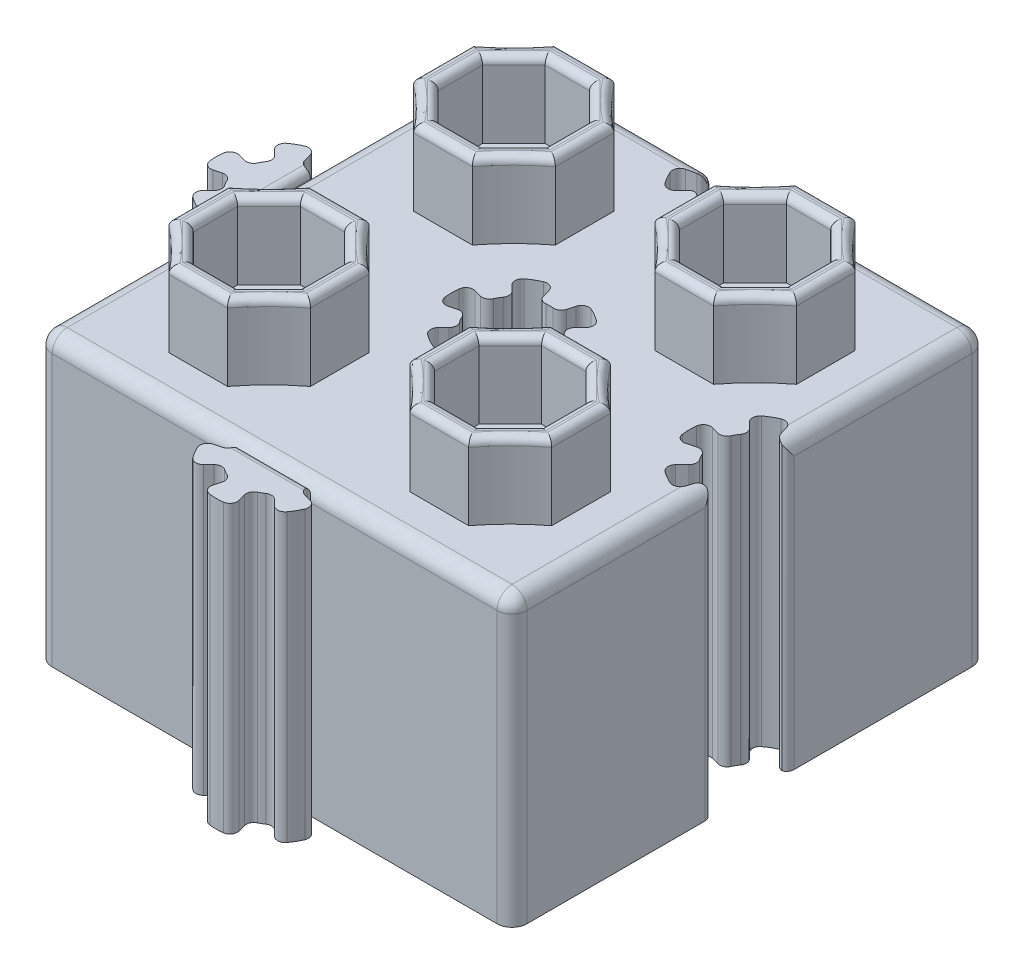
from build123d import *

# Parameters (mm, degrees)
SKETCH2_W                = 31.5
SKETCH2_H                = 31.5
BOSS_EXTRUDE1_DEPTH      = 19
CUT_EXTRUDE6_DEPTH       = 30.276697218
FILLET12_R               = 0.5
FILLET20_R               = 1
BOSS_EXTRUDE7_DEPTH      = 19
FILLET24_R               = 0.5
BOSS_EXTRUDE9_START      = -1
BOSS_EXTRUDE9_DEPTH      = 18
BOSS_EXTRUDE10_START     = -19
BOSS_EXTRUDE10_DEPTH     = 19
FILLET30_R               = 0.35
FILLET31_R               = 0.5
FILLET32_R               = 0.5
CUT_EXTRUDE13_DEPTH      = 2
CUT_EXTRUDE13_DEPTH_BACK = 1.5
BOSS_EXTRUDE11_DEPTH     = 5
FILLET33_R               = 0.5
CUT_EXTRUDE14_DEPTH      = 15
SKETCH18_W               = 1.2
SKETCH18_H               = 1.5
CUT_EXTRUDE15_DEPTH      = 0.025
CUT_EXTRUDE16_START      = -1.5
CUT_EXTRUDE16_DEPTH      = 1.5
CUT_EXTRUDE17_REACH      = 33.548
FILLET34_R               = 0.5
FILLET35_START           = -1
FILLET35_DEPTH           = 16


with BuildPart() as part:
    # Sketch2 → Boss-Extrude1 (new body)
    with BuildSketch(Plane(origin=(0, 0, 0), x_dir=(1, 0, 0), z_dir=(0, 1, 0))):
        Rectangle(SKETCH2_W, SKETCH2_H)
    extrude(amount=BOSS_EXTRUDE1_DEPTH)

    # Sketch5 → Cut-Extrude6 (cut, through all)
    with BuildSketch(Plane(origin=(0, 19, 0), x_dir=(1, 0, 0), z_dir=(0, 1, 0))):
        with BuildLine():
            Line((-2.828427125, 12.921572875), (-1.767766953, 13.982233047))
            ThreePointArc((-1.767766953, 13.982233047), (-2.165063509, 14.5), (-2.414814566, 15.102952387))
            Line((-2.414814566, 15.102952387), (-3.863703305, 14.71472382))
            ThreePointArc((-3.863703305, 14.71472382), (-3.464101615, 13.75), (-2.828427125, 12.921572875))
        make_face()
        with BuildLine():
            Line((1.03527618, 11.886296695), (0.647047613, 13.335185434))
            ThreePointArc((0.647047613, 13.335185434), (0, 13.25), (-0.647047613, 13.335185434))
            Line((-0.647047613, 13.335185434), (-1.03527618, 11.886296695))
            ThreePointArc((-1.03527618, 11.886296695), (0, 11.75), (1.03527618, 11.886296695))
        make_face()
        with BuildLine():
            ThreePointArc((2.414814566, 15.102952387), (2.165063509, 14.5), (1.767766953, 13.982233047))
            Line((1.767766953, 13.982233047), (2.828427125, 12.921572875))
            ThreePointArc((2.828427125, 12.921572875), (3.464101615, 13.75), (3.863703305, 14.71472382))
            Line((3.863703305, 14.71472382), (2.414814566, 15.102952387))
        make_face()
        with BuildLine():
            ThreePointArc((-0.647047613, 13.335185434), (0, 13.25), (0.647047613, 13.335185434))
            ThreePointArc((0.647047613, 13.335185434), (1.25, 13.584936491), (1.767766953, 13.982233047))
            ThreePointArc((1.767766953, 13.982233047), (2.165063509, 14.5), (2.414814566, 15.102952387))
            ThreePointArc((2.414814566, 15.102952387), (2.478612153, 15.423684519), (2.5, 15.75))
            Line((2.5, 15.75), (0, 15.75))
            Line((0, 15.75), (-2.5, 15.75))
            ThreePointArc((-2.5, 15.75), (-2.478612153, 15.423684519), (-2.414814566, 15.102952387))
            ThreePointArc((-2.414814566, 15.102952387), (-2.165063509, 14.5), (-1.767766953, 13.982233047))
            ThreePointArc((-1.767766953, 13.982233047), (-1.25, 13.584936491), (-0.647047613, 13.335185434))
        make_face()
        with BuildLine():
            Line((15.75, -2.5), (15.75, 0))
            Line((15.75, 0), (15.75, 2.5))
            ThreePointArc((15.75, 2.5), (15.423684519, 2.478612153), (15.102952387, 2.414814566))
            ThreePointArc((15.102952387, 2.414814566), (14.5, 2.165063509), (13.982233047, 1.767766953))
            ThreePointArc((13.982233047, 1.767766953), (13.584936491, 1.25), (13.335185434, 0.647047613))
            ThreePointArc((13.335185434, 0.647047613), (13.25, 0), (13.335185434, -0.647047613))
            ThreePointArc((13.335185434, -0.647047613), (13.584936491, -1.25), (13.982233047, -1.767766953))
            ThreePointArc((13.982233047, -1.767766953), (14.5, -2.165063509), (15.102952387, -2.414814566))
            ThreePointArc((15.102952387, -2.414814566), (15.423684519, -2.478612153), (15.75, -2.5))
        make_face()
        with BuildLine():
            ThreePointArc((13.982233047, 1.767766953), (14.5, 2.165063509), (15.102952387, 2.414814566))
            Line((15.102952387, 2.414814566), (14.71472382, 3.863703305))
            ThreePointArc((14.71472382, 3.863703305), (13.75, 3.464101615), (12.921572875, 2.828427125))
            Line((12.921572875, 2.828427125), (13.982233047, 1.767766953))
        make_face()
        with BuildLine():
            Line((11.886296695, -1.03527618), (13.335185434, -0.647047613))
            ThreePointArc((13.335185434, -0.647047613), (13.25, 0), (13.335185434, 0.647047613))
            Line((13.335185434, 0.647047613), (11.886296695, 1.03527618))
            ThreePointArc((11.886296695, 1.03527618), (11.75, 0), (11.886296695, -1.03527618))
        make_face()
        with BuildLine():
            Line((14.71472382, -3.863703305), (15.102952387, -2.414814566))
            ThreePointArc((15.102952387, -2.414814566), (14.5, -2.165063509), (13.982233047, -1.767766953))
            Line((13.982233047, -1.767766953), (12.921572875, -2.828427125))
            ThreePointArc((12.921572875, -2.828427125), (13.75, -3.464101615), (14.71472382, -3.863703305))
        make_face()
    extrude(amount=-CUT_EXTRUDE6_DEPTH, mode=Mode.SUBTRACT)

    # Fillet12
    # the kernel refuses this fillet: 0.5 mm, written as the material it adds along each edge
    with BuildSketch(Plane(origin=(-2.828427125, 19, -12.921572875), x_dir=(0.7071067811865464, 0, -0.7071067811865488), z_dir=(0, -1, 0)), Plane(origin=(3.863703305, 19, -14.71472382), x_dir=(-0.9659258262890686, 0, -0.25881904510251896), z_dir=(0, -1, 0)), Plane(origin=(1.03527618, 19, -11.886296695), x_dir=(-0.25881904510252407, 0, -0.9659258262890674), z_dir=(0, -1, 0)), Plane(origin=(14.71472382, 19, 3.863703305), x_dir=(0.2588190451025213, 0, -0.9659258262890682), z_dir=(0, -1, 0)), Plane(origin=(11.886296695, 19, 1.03527618), x_dir=(0.9659258262890664, 0, -0.258819045102527), z_dir=(0, -1, 0)), Plane(origin=(12.921572875, 19, -2.828427125), x_dir=(0.7071067811865517, 0, 0.7071067811865434), z_dir=(0, -1, 0))) as fillet12_piece_1:
        with BuildLine():
            CenterArc((0.535898385, -0.5), FILLET12_R, 90, 98.213210702)
            ThreePointArc((0.041026726, -0.571428571), (0.010269865, -0.286449736), (0, 0))
            Line((0, 0), (0.535898385, 0))
        make_face()
    extrude(amount=19)
    with BuildSketch(Plane(origin=(-3.863703305, 19, -14.71472382), x_dir=(0.32732683535398166, 0, 0.9449111825230705), z_dir=(0, -1, 0)), Plane(origin=(2.828427125, 19, -12.921572875), x_dir=(0.6546536707079763, 0, -0.7559289460184553), z_dir=(0, -1, 0)), Plane(origin=(-1.03527618, 19, -11.886296695), x_dir=(0.9819805060619656, 0, 0.18898223650461393), z_dir=(0, -1, 0)), Plane(origin=(12.921572875, 19, 2.828427125), x_dir=(0.7559289460184622, 0, 0.6546536707079684), z_dir=(0, -1, 0)), Plane(origin=(11.886296695, 19, -1.03527618), x_dir=(-0.1889822365046017, 0, 0.9819805060619681), z_dir=(0, -1, 0)), Plane(origin=(14.71472382, 19, -3.863703305), x_dir=(-0.9449111825230665, 0, 0.327326835353993), z_dir=(0, -1, 0))) as fillet12_piece_2:
        with BuildLine():
            CenterArc((0.537093255, -0.498716267), FILLET12_R, 85.893394649, 98.213210702)
            Line((0.038376988, -0.534522484), (0, 0))
            ThreePointArc((0, 0), (0.286449736, 0.010269865), (0.572899472, 0))
        make_face()
    extrude(amount=19)
    # the kernel refuses this fillet: 0.5 mm, written as the material it takes off along each edge
    with BuildSketch(Plane(origin=(15.75, 20.145099729, -2.5), x_dir=(-0.996497189454961, 0, 0.08362626027967186), z_dir=(0, -1, 0)), Plane(origin=(15.102952387, 20.145099729, 2.414814566), x_dir=(0.9841864399500989, 0, 0.1771356864619615), z_dir=(0, -1, 0)), Plane(origin=(13.335185434, 20.145099729, 0.647047613), x_dir=(0.33868921558220527, 0, 0.9408983022879309), z_dir=(0, -1, 0)), Plane(origin=(13.982233047, 20.145099729, -1.767766953), x_dir=(-0.645497224367904, 0, 0.7637626158259723), z_dir=(0, -1, 0))) as fillet12_2_piece_1:
        with BuildLine():
            CenterArc((0.459944432, 0.498248595), FILLET12_R, 184.797034113, 80.405931773)
            Line((-0.038304163, 0.456435465), (0, 0))
            ThreePointArc((0, 0), (0.209065651, 0.008757026), (0.418131301, 0))
        make_face()
    extrude(amount=21.290199458, mode=Mode.SUBTRACT)
    with BuildSketch(Plane(origin=(15.75, 20.145099729, 2.5), x_dir=(0, 0, 1), z_dir=(0, -1, 0)), Plane(origin=(13.982233047, 20.145099729, 1.767766953), x_dir=(-0.7071067811865388, 0, 0.7071067811865562), z_dir=(0, -1, 0)), Plane(origin=(13.335185434, 20.145099729, -0.647047613), x_dir=(-0.9659258262890702, 0, -0.2588190451025135), z_dir=(0, -1, 0)), Plane(origin=(15.102952387, 20.145099729, -2.414814566), x_dir=(-0.25881904510252224, 0, -0.9659258262890679), z_dir=(0, -1, 0))) as fillet12_2_piece_2:
        with BuildLine():
            CenterArc((0.458039892, 0.5), FILLET12_R, 189.594068227, 80.405931773)
            ThreePointArc((-0.034966757, 0.416666667), (-0.008757026, 0.209065651), (0, 0))
            Line((0, 0), (0.458039892, 0))
        make_face()
    extrude(amount=21.290199458, mode=Mode.SUBTRACT)

    # Fillet20
    # the kernel refuses this fillet: 1 mm, written as the material it takes off along each edge
    with BuildSketch(Plane(origin=(14.75, 18, 14.75), x_dir=(0, 0, 1), z_dir=(1, 0, 0))) as fillet20_piece_1_section:
        Polygon((0, 0), (FILLET20_R * 1.02, 0), (FILLET20_R * 1.02, -FILLET20_R * 1.02), (0, -FILLET20_R * 1.02), align=None)
    fillet20_piece_1 = extrude(amount=FILLET20_R * 1.02, mode=Mode.PRIVATE)
    fillet20_piece_1 = fillet20_piece_1 - Plane(origin=(14.75, 18, 14.75), x_dir=(0, -0.7071067811865475, -0.7071067811865475), z_dir=(1, 0, 0)) * Sphere(FILLET20_R, mode=Mode.PRIVATE)
    add(fillet20_piece_1, mode=Mode.SUBTRACT)
    with BuildSketch(Plane(origin=(14.75, 18, -14.75), x_dir=(0, 0, -1), z_dir=(0, 1, 0))) as fillet20_piece_2_section:
        Polygon((0, 0), (FILLET20_R * 1.02, 0), (FILLET20_R * 1.02, -FILLET20_R * 1.02), (0, -FILLET20_R * 1.02), align=None)
    fillet20_piece_2 = extrude(amount=FILLET20_R * 1.02, mode=Mode.PRIVATE)
    fillet20_piece_2 = fillet20_piece_2 - Plane(origin=(14.75, 18, -14.75), x_dir=(-0.7071067811865475, 0, 0.7071067811865477), z_dir=(0, 1, 0)) * Sphere(FILLET20_R, mode=Mode.PRIVATE)
    add(fillet20_piece_2, mode=Mode.SUBTRACT)
    with BuildSketch(Plane(origin=(-14.75, 18, -14.75), x_dir=(-1, 0, 0), z_dir=(0, 1, 0))) as fillet20_piece_3_section:
        Polygon((0, 0), (FILLET20_R * 1.02, 0), (FILLET20_R * 1.02, -FILLET20_R * 1.02), (0, -FILLET20_R * 1.02), align=None)
    fillet20_piece_3 = extrude(amount=FILLET20_R * 1.02, mode=Mode.PRIVATE)
    fillet20_piece_3 = fillet20_piece_3 - Plane(origin=(-14.75, 18, -14.75), x_dir=(0.7071067811865476, 0, 0.7071067811865474), z_dir=(0, 1, 0)) * Sphere(FILLET20_R, mode=Mode.PRIVATE)
    add(fillet20_piece_3, mode=Mode.SUBTRACT)
    with BuildSketch(Plane(origin=(-14.75, 18, 14.75), x_dir=(-1, 0, 0), z_dir=(0, 0, 1))) as fillet20_piece_4_section:
        Polygon((0, 0), (FILLET20_R * 1.02, 0), (FILLET20_R * 1.02, -FILLET20_R * 1.02), (0, -FILLET20_R * 1.02), align=None)
    fillet20_piece_4 = extrude(amount=FILLET20_R * 1.02, mode=Mode.PRIVATE)
    fillet20_piece_4 = fillet20_piece_4 - Plane(origin=(-14.75, 18, 14.75), x_dir=(0.7071067811865475, -0.7071067811865475, 0), z_dir=(0, 0, 1)) * Sphere(FILLET20_R, mode=Mode.PRIVATE)
    add(fillet20_piece_4, mode=Mode.SUBTRACT)
    with BuildSketch(Plane(origin=(15.75, -2.5, 15.75), x_dir=(0, 0, -1), z_dir=(0, 1, 0)), Plane(origin=(15.75, -2.5, -15.75), x_dir=(-1, 0, 0), z_dir=(0, 1, 0)), Plane(origin=(-15.75, -2.5, -15.75), x_dir=(0, 0, 1), z_dir=(0, 1, 0)), Plane(origin=(-15.75, -2.5, 15.75), x_dir=(1, 0, 0), z_dir=(0, 1, 0))) as fillet20_piece_5:
        with BuildLine():
            CenterArc((FILLET20_R, FILLET20_R), FILLET20_R, 180, 90)
            Line((0, FILLET20_R), (0, 0))
            Line((0, 0), (FILLET20_R, 0))
        make_face()
    extrude(amount=20.5, mode=Mode.SUBTRACT)
    with BuildSketch(Plane(origin=(-14.75, 19, -15.75), x_dir=(0, 0, 1), z_dir=(1, 0, 0)), Plane(origin=(0, 19, -15.75), x_dir=(0, 0, 1), z_dir=(1, 0, 0))) as fillet20_piece_6:
        with BuildLine():
            CenterArc((FILLET20_R, FILLET20_R), FILLET20_R, 180, 90)
            Line((0, FILLET20_R), (0, 0))
            Line((0, 0), (FILLET20_R, 0))
        make_face()
    extrude(amount=14.75, mode=Mode.SUBTRACT)
    with BuildSketch(Plane(origin=(15.75, 19, -14.75), x_dir=(-1, 0, 0), z_dir=(0, 0, 1)), Plane(origin=(15.75, 19, 0.458039892), x_dir=(-1, 0, 0), z_dir=(0, 0, 1))) as fillet20_piece_7:
        with BuildLine():
            CenterArc((FILLET20_R, FILLET20_R), FILLET20_R, 180, 90)
            Line((0, FILLET20_R), (0, 0))
            Line((0, 0), (FILLET20_R, 0))
        make_face()
    extrude(amount=14.291960108, mode=Mode.SUBTRACT)
    with BuildSketch(Plane(origin=(14.75, 19, 15.75), x_dir=(0, 0, -1), z_dir=(-1, 0, 0)), Plane(origin=(-15.75, 19, 14.75), x_dir=(1, 0, 0), z_dir=(0, 0, -1))) as fillet20_piece_8:
        with BuildLine():
            CenterArc((FILLET20_R, FILLET20_R), FILLET20_R, 180, 90)
            Line((0, FILLET20_R), (0, 0))
            Line((0, 0), (FILLET20_R, 0))
        make_face()
    extrude(amount=29.5, mode=Mode.SUBTRACT)

    # Sketch6 → Boss-Extrude7 (add, through all)
    with BuildSketch(Plane(origin=(0, 19, 0), x_dir=(1, 0, 0), z_dir=(0, 1, 0))):
        with BuildLine():
            ThreePointArc((-2.375, -15.75), (-2.354681546, -16.059999707), (-2.294073837, -16.364695232))
            Line((-2.294073837, -16.364695232), (-3.742962577, -16.7529238))
            ThreePointArc((-3.742962577, -16.7529238), (-3.35584844, -17.6875), (-2.740038777, -18.490038777))
            Line((-2.740038777, -18.490038777), (-1.679378605, -17.429378605))
            ThreePointArc((-1.679378605, -17.429378605), (-1.189926656, -17.805407393), (-0.620108527, -18.0426165))
            Line((-0.620108527, -18.0426165), (-1.011756018, -19.490584815))
            ThreePointArc((-1.011756018, -19.490584815), (0, -19.625), (1.011756018, -19.490584815))
            Line((1.011756018, -19.490584815), (0.620108527, -18.0426165))
            ThreePointArc((0.620108527, -18.0426165), (1.189926656, -17.805407393), (1.679378605, -17.429378605))
            Line((1.679378605, -17.429378605), (2.740038777, -18.490038777))
            ThreePointArc((2.740038777, -18.490038777), (3.35584844, -17.6875), (3.742962577, -16.7529238))
            Line((3.742962577, -16.7529238), (2.294073837, -16.364695232))
            ThreePointArc((2.294073837, -16.364695232), (2.354681546, -16.059999707), (2.375, -15.75))
            Line((2.375, -15.75), (-2.375, -15.75))
        make_face()
        with BuildLine():
            Line((-15.75, -2.375), (-15.75, 2.375))
            ThreePointArc((-15.75, 2.375), (-16.059999707, 2.354681546), (-16.364695232, 2.294073837))
            Line((-16.364695232, 2.294073837), (-16.7529238, 3.742962577))
            ThreePointArc((-16.7529238, 3.742962577), (-17.6875, 3.35584844), (-18.490038777, 2.740038777))
            Line((-18.490038777, 2.740038777), (-17.429378605, 1.679378605))
            ThreePointArc((-17.429378605, 1.679378605), (-17.806810334, 1.1875), (-18.044073837, 0.614695232))
            Line((-18.044073837, 0.614695232), (-19.492962577, 1.0029238))
            ThreePointArc((-19.492962577, 1.0029238), (-19.625, 0), (-19.492962577, -1.0029238))
            Line((-19.492962577, -1.0029238), (-18.044073837, -0.614695232))
            ThreePointArc((-18.044073837, -0.614695232), (-17.806810334, -1.1875), (-17.429378605, -1.679378605))
            Line((-17.429378605, -1.679378605), (-18.490038777, -2.740038777))
            ThreePointArc((-18.490038777, -2.740038777), (-17.6875, -3.35584844), (-16.7529238, -3.742962577))
            Line((-16.7529238, -3.742962577), (-16.364695232, -2.294073837))
            ThreePointArc((-16.364695232, -2.294073837), (-16.059999707, -2.354681546), (-15.75, -2.375))
        make_face()
    extrude(amount=-BOSS_EXTRUDE7_DEPTH)

    # Fillet24
    fillet24_edges = [part.edges().sort_by_distance(p)[0] for p in [
        (-16.364695232, 9.5, 2.294073837),
        (-16.7529238, 9.5, 3.742962577),
        (-18.490038777, 9.5, 2.740038777),
        (-17.429378605, 9.5, 1.679378605),
        (-18.044073837, 9.5, 0.614695232),
        (-19.492962577, 9.5, 1.0029238),
        (-19.492962577, 9.5, -1.0029238),
        (-18.044073837, 9.5, -0.614695232),
        (-17.429378605, 9.5, -1.679378605),
        (-18.490038777, 9.5, -2.740038777),
        (-16.7529238, 9.5, -3.742962577),
        (-16.364695232, 9.5, -2.294073837),
        (0.620108527, 9.5, 18.0426165),
        (1.011756018, 9.5, 19.490584815),
        (-1.011756018, 9.5, 19.490584815),
        (-0.620108527, 9.5, 18.0426165),
        (-1.679378605, 9.5, 17.429378605),
        (-2.740038777, 9.5, 18.490038777),
        (-3.742962577, 9.5, 16.7529238),
        (-2.294073837, 9.5, 16.364695232),
        (2.294073837, 9.5, 16.364695232),
        (3.742962577, 9.5, 16.7529238),
        (2.740038777, 9.5, 18.490038777),
        (1.679378605, 9.5, 17.429378605),
    ]]
    fillet(fillet24_edges, radius=FILLET24_R)

    # Sketch10 → Boss-Extrude9 (add, through all)
    with BuildSketch(Plane(origin=(0, 19, 0), x_dir=(1, 0, 0), z_dir=(0, 1, 0)).offset(BOSS_EXTRUDE9_START)):
        with BuildLine():
            Line((15.75, 4.4), (15.75, 4))
            ThreePointArc((15.75, 4), (11.75, 0), (15.75, -4))
            Line((15.75, -4), (15.75, -4.4))
            ThreePointArc((15.75, -4.4), (11.35, 0), (15.75, 4.4))
        make_face()
        with BuildLine():
            Line((-4.4, 15.75), (-4, 15.75))
            ThreePointArc((-4, 15.75), (0, 11.75), (4, 15.75))
            Line((4, 15.75), (4.4, 15.75))
            ThreePointArc((4.4, 15.75), (0, 11.35), (-4.4, 15.75))
        make_face()
    extrude(amount=-BOSS_EXTRUDE9_DEPTH)

    # Boss-Extrude10: read off the stored shape, not the designer's step
    # Boss-Extrude10 outline → Boss-Extrude10 (add)
    with BuildSketch(Plane(origin=(0, 19, 0), x_dir=(1, 0, 0), z_dir=(0, 1, 0)).offset(BOSS_EXTRUDE10_START)):
        with BuildLine():
            Line((13.658349934, -2.091650066), (14.070621395, -1.679378605))
            ThreePointArc((14.070621395, -1.679378605), (13.693189666, -1.1875), (13.455926163, -0.614695232))
            Line((13.455926163, -0.614695232), (12.892752874, -0.76559706))
            ThreePointArc((12.892752874, -0.76559706), (13.235075461, -0.796157468), (13.476801997, -1.040466644))
            ThreePointArc((13.476801997, -1.040466644), (13.584936491, -1.25), (13.712330453, -1.448413896))
            ThreePointArc((13.712330453, -1.448413896), (13.803045138, -1.779909805), (13.658349934, -2.091650066))
        make_face()
    extrude(amount=BOSS_EXTRUDE10_DEPTH)

    # Fillet30
    fillet30_edges = [part.edges().sort_by_distance(p)[0] for p in [
        (2.493564071, 18.571318411, -15.570728498),
        (-2.493564071, 18.571318411, -15.570728498),
        (2.5, 9, -15.75),
        (2.414814566, 9.467820642, -15.102952387),
        (-2.414814566, 9.467820642, -15.102952387),
        (-2.5, 9, -15.75),
        (-1.767766953, 9.5, -13.982233047),
        (-0.647047613, 9.5, -13.335185434),
        (0.647047613, 9.5, -13.335185434),
    ]]
    fillet(fillet30_edges, radius=FILLET30_R)

    # Fillet31
    fillet31_edges = [part.edges().sort_by_distance(p)[0] for p in [
        (0, 19, 15.75),
        (-15.75, 19, 0),
    ]]
    fillet(fillet31_edges, radius=FILLET31_R)

    # Fillet32
    fillet32_edges = [part.edges().sort_by_distance(p)[0] for p in [
        (13.455926163, 9.5, 0.614695232),
        (14.070621395, 9.5, 1.679378605),
    ]]
    fillet(fillet32_edges, radius=FILLET32_R)

    # Sketch16 → Cut-Extrude13 (cut, two sides: drawn at the far end of the back side and taken through both)
    with BuildSketch(Plane.XZ.offset(-CUT_EXTRUDE13_DEPTH_BACK)):
        with BuildLine():
            Line((-14.3, 14.3), (-8.175, 14.3))
            Line((-8.175, 14.3), (-8.175, 12.6))
            ThreePointArc((-8.175, 12.6), (-8.145710678, 12.529289322), (-8.075, 12.5))
            Line((-8.075, 12.5), (-6.825, 12.5))
            ThreePointArc((-6.825, 12.5), (-6.754289322, 12.529289322), (-6.725, 12.6))
            Line((-6.725, 12.6), (-6.725, 14.3))
            Line((-6.725, 14.3), (6.721665956, 14.3))
            Line((6.721665956, 14.3), (6.721665956, 12.6))
            ThreePointArc((6.721665956, 12.6), (6.750955278, 12.529289322), (6.821665956, 12.5))
            Line((6.821665956, 12.5), (8.071665956, 12.5))
            ThreePointArc((8.071665956, 12.5), (8.142376634, 12.529289322), (8.171665956, 12.6))
            Line((8.171665956, 12.6), (8.171665956, 14.3))
            Line((8.171665956, 14.3), (14.3, 14.3))
            Line((14.3, 14.3), (14.3, 8.175))
            Line((14.3, 8.175), (12.6, 8.175))
            ThreePointArc((12.6, 8.175), (12.529289322, 8.145710678), (12.5, 8.075))
            Line((12.5, 8.075), (12.5, 6.825))
            ThreePointArc((12.5, 6.825), (12.529289322, 6.754289322), (12.6, 6.725))
            Line((12.6, 6.725), (14.3, 6.725))
            Line((14.3, 6.725), (14.3, 4.623310502))
            ThreePointArc((14.3, 4.623310502), (11.956404012, 3.135991924), (10.82799643, 0.6))
            ThreePointArc((10.82799643, 0.6), (10.782740417, 0), (10.82799643, -0.6))
            ThreePointArc((10.82799643, -0.6), (11.956404012, -3.135991924), (14.3, -4.623310502))
            Line((14.3, -4.623310502), (14.3, -6.725))
            Line((14.3, -6.725), (12.6, -6.725))
            ThreePointArc((12.6, -6.725), (12.529289322, -6.754289322), (12.5, -6.825))
            Line((12.5, -6.825), (12.5, -8.075))
            ThreePointArc((12.5, -8.075), (12.529289322, -8.145710678), (12.6, -8.175))
            Line((12.6, -8.175), (14.3, -8.175))
            Line((14.3, -8.175), (14.3, -14.3))
            Line((14.3, -14.3), (8.35038088, -14.3))
            Line((8.35038088, -14.3), (8.171665956, -14.3))
            Line((8.171665956, -14.3), (8.171665956, -12.6))
            ThreePointArc((8.171665956, -12.6), (8.142376634, -12.529289322), (8.071665956, -12.5))
            Line((8.071665956, -12.5), (6.821665956, -12.5))
            ThreePointArc((6.821665956, -12.5), (6.750955278, -12.529289322), (6.721665956, -12.6))
            Line((6.721665956, -12.6), (6.721665956, -14.3))
            Line((6.721665956, -14.3), (4.623310502, -14.3))
            Line((4.623310502, -14.3), (4.575751304, -14.3))
            ThreePointArc((4.575751304, -14.3), (3.072656017, -12.062346952), (0.600502286, -10.987710949))
            ThreePointArc((0.600502286, -10.987710949), (-0.001645996, -10.942336934), (-0.603763067, -10.988123252))
            ThreePointArc((-0.603763067, -10.988123252), (-3.073918375, -12.063399151), (-4.575751304, -14.3))
            Line((-4.575751304, -14.3), (-4.623310502, -14.3))
            Line((-4.623310502, -14.3), (-6.725, -14.3))
            Line((-6.725, -14.3), (-6.725, -12.6))
            ThreePointArc((-6.725, -12.6), (-6.754289322, -12.529289322), (-6.825, -12.5))
            Line((-6.825, -12.5), (-8.075, -12.5))
            ThreePointArc((-8.075, -12.5), (-8.145710678, -12.529289322), (-8.175, -12.6))
            Line((-8.175, -12.6), (-8.175, -14.3))
            Line((-8.175, -14.3), (-14.3, -14.3))
            Line((-14.3, -14.3), (-14.3, -8.175))
            Line((-14.3, -8.175), (-12.6, -8.175))
            ThreePointArc((-12.6, -8.175), (-12.529289322, -8.145710678), (-12.5, -8.075))
            Line((-12.5, -8.075), (-12.5, -6.825))
            ThreePointArc((-12.5, -6.825), (-12.529289322, -6.754289322), (-12.6, -6.725))
            Line((-12.6, -6.725), (-14.3, -6.725))
            Line((-14.3, -6.725), (-14.3, 6.725))
            Line((-14.3, 6.725), (-12.6, 6.725))
            ThreePointArc((-12.6, 6.725), (-12.529289322, 6.754289322), (-12.5, 6.825))
            Line((-12.5, 6.825), (-12.5, 8.075))
            ThreePointArc((-12.5, 8.075), (-12.529289322, 8.145710678), (-12.6, 8.175))
            Line((-12.6, 8.175), (-14.3, 8.175))
            Line((-14.3, 8.175), (-14.3, 14.3))
        make_face()
    extrude(amount=CUT_EXTRUDE13_DEPTH + CUT_EXTRUDE13_DEPTH_BACK, mode=Mode.SUBTRACT)

    # Sketch3 → Boss-Extrude11 (add)
    # profile 1 of 4: a face of its own
    with BuildSketch(Plane(origin=(0, 19, 0), x_dir=(1, 0, 0), z_dir=(0, 1, 0))):
        with BuildLine():
            ThreePointArc((-9.946803743, 3.421093296), (-11.233690264, 4.887403031), (-12.7, 6.174289552))
            Line((-12.7, 6.174289552), (-12.7, 10.067897039))
            ThreePointArc((-12.7, 10.067897039), (-11.233690264, 11.35478356), (-9.946803743, 12.821093296))
            Line((-9.946803743, 12.821093296), (-6.053196257, 12.821093296))
            ThreePointArc((-6.053196257, 12.821093296), (-4.766309736, 11.35478356), (-3.3, 10.067897039))
            Line((-3.3, 10.067897039), (-3.3, 6.174289552))
            ThreePointArc((-3.3, 6.174289552), (-4.766309736, 4.887403031), (-6.053196257, 3.421093296))
            Line((-6.053196257, 3.421093296), (-9.946803743, 3.421093296))
        make_face()
        Polygon((-9.470458146, 4.571093296), (-6.529541854, 4.571093296), (-4.45, 6.650635149), (-4.45, 9.591551442), (-6.529541854, 11.671093296), (-9.470458146, 11.671093296), (-11.55, 9.591551442), (-11.55, 6.650635149), align=None, mode=Mode.SUBTRACT)
    # profile 2 of 4: a face of its own
    with BuildSketch(Plane(origin=(0, 19, 0), x_dir=(1, 0, 0), z_dir=(0, 1, 0))):
        with BuildLine():
            Line((12.7, 10.067897039), (12.7, 6.174289552))
            ThreePointArc((12.7, 6.174289552), (11.233690264, 4.887403031), (9.946803743, 3.421093296))
            Line((9.946803743, 3.421093296), (6.053196257, 3.421093296))
            ThreePointArc((6.053196257, 3.421093296), (4.766309736, 4.887403031), (3.3, 6.174289552))
            Line((3.3, 6.174289552), (3.3, 10.067897039))
            ThreePointArc((3.3, 10.067897039), (4.766309736, 11.35478356), (6.053196257, 12.821093296))
            Line((6.053196257, 12.821093296), (9.946803743, 12.821093296))
            ThreePointArc((9.946803743, 12.821093296), (11.233690264, 11.35478356), (12.7, 10.067897039))
        make_face()
        Polygon((9.470458146, 4.571093296), (6.529541854, 4.571093296), (4.45, 6.650635149), (4.45, 9.591551442), (6.529541854, 11.671093296), (9.470458146, 11.671093296), (11.55, 9.591551442), (11.55, 6.650635149), align=None, mode=Mode.SUBTRACT)
    # profile 3 of 4: a face of its own
    with BuildSketch(Plane(origin=(0, 19, 0), x_dir=(1, 0, 0), z_dir=(0, 1, 0))):
        with BuildLine():
            ThreePointArc((9.946803743, -3.421093296), (11.233690264, -4.887403031), (12.7, -6.174289552))
            Line((12.7, -6.174289552), (12.7, -10.067897039))
            ThreePointArc((12.7, -10.067897039), (11.233690264, -11.35478356), (9.946803743, -12.821093296))
            Line((9.946803743, -12.821093296), (6.053196257, -12.821093296))
            ThreePointArc((6.053196257, -12.821093296), (4.766309736, -11.35478356), (3.3, -10.067897039))
            Line((3.3, -10.067897039), (3.3, -6.174289552))
            ThreePointArc((3.3, -6.174289552), (4.766309736, -4.887403031), (6.053196257, -3.421093296))
            Line((6.053196257, -3.421093296), (9.946803743, -3.421093296))
        make_face()
        Polygon((9.470458146, -4.571093296), (6.529541854, -4.571093296), (4.45, -6.650635149), (4.45, -9.591551442), (6.529541854, -11.671093296), (9.470458146, -11.671093296), (11.55, -9.591551442), (11.55, -6.650635149), align=None, mode=Mode.SUBTRACT)
    # profile 4 of 4: a face of its own
    with BuildSketch(Plane(origin=(0, 19, 0), x_dir=(1, 0, 0), z_dir=(0, 1, 0))):
        with BuildLine():
            Line((-12.7, -10.067897039), (-12.7, -6.174289552))
            ThreePointArc((-12.7, -6.174289552), (-11.233690264, -4.887403031), (-9.946803743, -3.421093296))
            Line((-9.946803743, -3.421093296), (-6.053196257, -3.421093296))
            ThreePointArc((-6.053196257, -3.421093296), (-4.766309736, -4.887403031), (-3.3, -6.174289552))
            Line((-3.3, -6.174289552), (-3.3, -10.067897039))
            ThreePointArc((-3.3, -10.067897039), (-4.766309736, -11.35478356), (-6.053196257, -12.821093296))
            Line((-6.053196257, -12.821093296), (-9.946803743, -12.821093296))
            ThreePointArc((-9.946803743, -12.821093296), (-11.233690264, -11.35478356), (-12.7, -10.067897039))
        make_face()
        Polygon((-9.470458146, -4.571093296), (-6.529541854, -4.571093296), (-4.45, -6.650635149), (-4.45, -9.591551442), (-6.529541854, -11.671093296), (-9.470458146, -11.671093296), (-11.55, -9.591551442), (-11.55, -6.650635149), align=None, mode=Mode.SUBTRACT)
    extrude(amount=BOSS_EXTRUDE11_DEPTH)

    # Fillet33
    fillet33_edges = [part.edges().sort_by_distance(p)[0] for p in [
        (-8, 24, -4.571093296),
        (-10.510229073, 24, -5.610864222),
        (-11.55, 24, -8.121093296),
        (-10.510229073, 24, -10.631322369),
        (-8, 24, -11.671093296),
        (-5.489770927, 24, -10.631322369),
        (-4.45, 24, -8.121093296),
        (-11.233690264, 24, -4.887403031),
        (-4.766309736, 24, -11.35478356),
        (-11.233690264, 24, -11.35478356),
        (-5.489770927, 24, -5.610864222),
        (-8, 24, -3.421093296),
        (-4.766309736, 24, -4.887403031),
        (-3.3, 24, -8.121093296),
        (-8, 24, -12.821093296),
        (-12.7, 24, -8.121093296),
        (12.7, 24, -8.121093296),
        (8, 24, -12.821093296),
        (3.3, 24, -8.121093296),
        (4.766309736, 24, -4.887403031),
        (8, 24, -3.421093296),
        (8, 24, -4.571093296),
        (5.489770927, 24, -5.610864222),
        (4.45, 24, -8.121093296),
        (5.489770927, 24, -10.631322369),
        (8, 24, -11.671093296),
        (10.510229073, 24, -10.631322369),
        (11.55, 24, -8.121093296),
        (10.510229073, 24, -5.610864222),
        (11.233690264, 24, -11.35478356),
        (4.766309736, 24, -11.35478356),
        (11.233690264, 24, -4.887403031),
        (8, 24, 4.571093296),
        (10.510229073, 24, 5.610864222),
        (11.55, 24, 8.121093296),
        (10.510229073, 24, 10.631322369),
        (8, 24, 11.671093296),
        (5.489770927, 24, 10.631322369),
        (4.45, 24, 8.121093296),
        (11.233690264, 24, 4.887403031),
        (4.766309736, 24, 11.35478356),
        (11.233690264, 24, 11.35478356),
        (5.489770927, 24, 5.610864222),
        (8, 24, 3.421093296),
        (4.766309736, 24, 4.887403031),
        (3.3, 24, 8.121093296),
        (8, 24, 12.821093296),
        (12.7, 24, 8.121093296),
        (-12.7, 24, 8.121093296),
        (-8, 24, 12.821093296),
        (-3.3, 24, 8.121093296),
        (-4.766309736, 24, 4.887403031),
        (-8, 24, 3.421093296),
        (-8, 24, 4.571093296),
        (-5.489770927, 24, 5.610864222),
        (-4.45, 24, 8.121093296),
        (-5.489770927, 24, 10.631322369),
        (-8, 24, 11.671093296),
        (-10.510229073, 24, 10.631322369),
        (-11.55, 24, 8.121093296),
        (-10.510229073, 24, 5.610864222),
        (-11.233690264, 24, 11.35478356),
        (-4.766309736, 24, 11.35478356),
        (-11.233690264, 24, 4.887403031),
    ]]
    fillet(fillet33_edges, radius=FILLET33_R)

    # Sketch7 → Cut-Extrude14 (cut)
    with BuildSketch(Plane.XZ):
        with BuildLine():
            ThreePointArc((-4.259988263, -14.3), (-2.859722023, -12.275523068), (-0.603763067, -11.290687255))
            Line((-0.603763067, -11.290687255), (-0.603763067, -4.963413156))
            ThreePointArc((-0.603763067, -4.963413156), (-1.845028292, -4.647135742), (-2.965202778, -4.025862949))
            Line((-2.965202778, -4.025862949), (-3.959797975, -5.020458146))
            Line((-3.959797975, -5.020458146), (-5.020458146, -3.959797975))
            Line((-5.020458146, -3.959797975), (-4.027923069, -2.962403712))
            ThreePointArc((-4.027923069, -2.962403712), (-4.64847513, -1.841651151), (-4.963869458, -0.6))
            Line((-4.963869458, -0.6), (-14.325, -0.6))
            Line((-14.325, -0.6), (-14.325, -6.725))
            Line((-14.325, -6.725), (-12.675, -6.725))
            Line((-12.675, -6.725), (-12.675, -7.3))
            Line((-12.675, -7.3), (-14.325, -7.3))
            Line((-14.325, -7.3), (-14.325, -14.3))
            Line((-14.325, -14.3), (-7.325, -14.3))
            Line((-7.325, -14.3), (-7.325, -12.65))
            Line((-7.325, -12.65), (-6.725, -12.65))
            Line((-6.725, -12.65), (-6.725, -14.3))
            Line((-6.725, -14.3), (-4.259988263, -14.3))
        make_face()
        with BuildLine():
            ThreePointArc((14.3, -4.259988263), (12.274316834, -2.858255854), (11.290179376, -0.6))
            Line((11.290179376, -0.6), (4.963869458, -0.6))
            ThreePointArc((4.963869458, -0.6), (4.64847513, -1.841651151), (4.027923069, -2.962403712))
            Line((4.027923069, -2.962403712), (5.020458146, -3.959797975))
            Line((5.020458146, -3.959797975), (3.959797975, -5.020458146))
            Line((3.959797975, -5.020458146), (2.965202778, -4.025862949))
            ThreePointArc((2.965202778, -4.025862949), (1.843266601, -4.64783479), (0.6, -4.963869458))
            Line((0.6, -4.963869458), (0.6, -11.290179376))
            ThreePointArc((0.6, -11.290179376), (2.86843208, -12.282710367), (4.268415983, -14.325))
            Line((4.268415983, -14.325), (6.7, -14.325))
            Line((6.7, -14.325), (6.7, -12.525))
            Line((6.7, -12.525), (7.3, -12.525))
            Line((7.3, -12.525), (7.3, -14.325))
            Line((7.3, -14.325), (14.3, -14.325))
            Line((14.3, -14.325), (14.3, -7.325))
            Line((14.3, -7.325), (12.65, -7.325))
            Line((12.65, -7.325), (12.65, -6.725))
            Line((12.65, -6.725), (14.3, -6.725))
            Line((14.3, -6.725), (14.3, -4.259988263))
        make_face()
        with BuildLine():
            Line((7.571665956, 14.3), (0.6, 14.3))
            Line((0.6, 14.3), (0.6, 4.963869458))
            ThreePointArc((0.6, 4.963869458), (1.843266601, 4.64783479), (2.965202778, 4.025862949))
            Line((2.965202778, 4.025862949), (3.959797975, 5.020458146))
            Line((3.959797975, 5.020458146), (5.020458146, 3.959797975))
            Line((5.020458146, 3.959797975), (4.027923069, 2.962403712))
            ThreePointArc((4.027923069, 2.962403712), (4.64847513, 1.841651151), (4.963869458, 0.6))
            Line((4.963869458, 0.6), (11.290179376, 0.6))
            ThreePointArc((11.290179376, 0.6), (12.274316834, 2.858255854), (14.3, 4.259988263))
            Line((14.3, 4.259988263), (14.3, 6.7))
            Line((14.3, 6.7), (12.5, 6.7))
            Line((12.5, 6.7), (12.5, 7.3))
            Line((12.5, 7.3), (14.3, 7.3))
            Line((14.3, 7.3), (14.3, 14.3))
            Line((14.3, 14.3), (8.171665956, 14.3))
            Line((8.171665956, 14.3), (8.171665956, 12.65))
            Line((8.171665956, 12.65), (7.571665956, 12.65))
            Line((7.571665956, 12.65), (7.571665956, 14.3))
        make_face()
        with BuildLine():
            Line((-7.325, 14.3), (-14.325, 14.3))
            Line((-14.325, 14.3), (-14.325, 7.3))
            Line((-14.325, 7.3), (-12.525, 7.3))
            Line((-12.525, 7.3), (-12.525, 6.7))
            Line((-12.525, 6.7), (-14.325, 6.7))
            Line((-14.325, 6.7), (-14.325, 0.6))
            Line((-14.325, 0.6), (-4.963869458, 0.6))
            ThreePointArc((-4.963869458, 0.6), (-4.64847513, 1.841651151), (-4.027923069, 2.962403712))
            Line((-4.027923069, 2.962403712), (-5.020458146, 3.959797975))
            Line((-5.020458146, 3.959797975), (-3.959797975, 5.020458146))
            Line((-3.959797975, 5.020458146), (-2.965202778, 4.025862949))
            ThreePointArc((-2.965202778, 4.025862949), (-1.845028292, 4.647135742), (-0.603763067, 4.963413156))
            Line((-0.603763067, 4.963413156), (-0.603763067, 14.3))
            Line((-0.603763067, 14.3), (-6.725, 14.3))
            Line((-6.725, 14.3), (-6.725, 12.65))
            Line((-6.725, 12.65), (-7.325, 12.65))
            Line((-7.325, 12.65), (-7.325, 14.3))
        make_face()
        with BuildLine():
            ThreePointArc((2.828427125, 2.828427125), (2, 3.464101615), (1.03527618, 3.863703305))
            Line((1.03527618, 3.863703305), (0.647047613, 2.414814566))
            ThreePointArc((0.647047613, 2.414814566), (0, 2.5), (-0.647047613, 2.414814566))
            Line((-0.647047613, 2.414814566), (-1.03527618, 3.863703305))
            ThreePointArc((-1.03527618, 3.863703305), (-2, 3.464101615), (-2.828427125, 2.828427125))
            Line((-2.828427125, 2.828427125), (-1.767766953, 1.767766953))
            ThreePointArc((-1.767766953, 1.767766953), (-2.165063509, 1.25), (-2.414814566, 0.647047613))
            Line((-2.414814566, 0.647047613), (-3.863703305, 1.03527618))
            ThreePointArc((-3.863703305, 1.03527618), (-4, 0), (-3.863703305, -1.03527618))
            Line((-3.863703305, -1.03527618), (-2.414814566, -0.647047613))
            ThreePointArc((-2.414814566, -0.647047613), (-2.165063509, -1.25), (-1.767766953, -1.767766953))
            Line((-1.767766953, -1.767766953), (-2.828427125, -2.828427125))
            ThreePointArc((-2.828427125, -2.828427125), (-2, -3.464101615), (-1.03527618, -3.863703305))
            Line((-1.03527618, -3.863703305), (-0.647047613, -2.414814566))
            ThreePointArc((-0.647047613, -2.414814566), (0, -2.5), (0.647047613, -2.414814566))
            Line((0.647047613, -2.414814566), (1.03527618, -3.863703305))
            ThreePointArc((1.03527618, -3.863703305), (2, -3.464101615), (2.828427125, -2.828427125))
            Line((2.828427125, -2.828427125), (1.767766953, -1.767766953))
            ThreePointArc((1.767766953, -1.767766953), (2.165063509, -1.25), (2.414814566, -0.647047613))
            Line((2.414814566, -0.647047613), (3.863703305, -1.03527618))
            ThreePointArc((3.863703305, -1.03527618), (4, 0), (3.863703305, 1.03527618))
            Line((3.863703305, 1.03527618), (2.414814566, 0.647047613))
            ThreePointArc((2.414814566, 0.647047613), (2.165063509, 1.25), (1.767766953, 1.767766953))
            Line((1.767766953, 1.767766953), (2.828427125, 2.828427125))
        make_face()
    extrude(amount=-CUT_EXTRUDE14_DEPTH, mode=Mode.SUBTRACT)

    # Sketch18 → Cut-Extrude15 (cut)
    with BuildSketch(Plane(origin=(-14.3, 0, 0), x_dir=(0, 0, -1), z_dir=(1, 0, 0))):
        with Locations((0, 0.75)):
            Rectangle(SKETCH18_W, SKETCH18_H)
    extrude(amount=-CUT_EXTRUDE15_DEPTH, mode=Mode.SUBTRACT)

    # Sketch19 → Cut-Extrude16 (cut)
    with BuildSketch(Plane.XZ.offset(CUT_EXTRUDE16_START)):
        with BuildLine():
            Line((-0.603763067, -11.290687255), (-0.603763067, -10.988123252))
            ThreePointArc((-0.603763067, -10.988123252), (-0.001900018, -10.942337029), (0.6, -10.987634675))
            Line((0.6, -10.987634675), (0.6, -11.290179376))
            ThreePointArc((0.6, -11.290179376), (-0.001900748, -11.24489138), (-0.603763067, -11.290687255))
        make_face()
        with BuildLine():
            Line((11.290179376, 0.6), (10.82799643, 0.6))
            ThreePointArc((10.82799643, 0.6), (10.782740417, 0), (10.82799643, -0.6))
            Line((10.82799643, -0.6), (11.290179376, -0.6))
            ThreePointArc((11.290179376, -0.6), (11.244923362, 0), (11.290179376, 0.6))
        make_face()
    extrude(amount=CUT_EXTRUDE16_DEPTH, mode=Mode.SUBTRACT)

    # Sketch20 → Cut-Extrude17 (cut, up to next)
    with BuildSketch(Plane.XZ.offset(-15), mode=Mode.PRIVATE) as cut_extrude17_sk1:
        with BuildLine():
            ThreePointArc((-1.03527618, 3.863703305), (-2, 3.464101615), (-2.828427125, 2.828427125))
            Line((-2.828427125, 2.828427125), (-1.767766953, 1.767766953))
            ThreePointArc((-1.767766953, 1.767766953), (-2.165063509, 1.25), (-2.414814566, 0.647047613))
            Line((-2.414814566, 0.647047613), (-3.863703305, 1.03527618))
            ThreePointArc((-3.863703305, 1.03527618), (-4, 0), (-3.863703305, -1.03527618))
            Line((-3.863703305, -1.03527618), (-2.414814566, -0.647047613))
            ThreePointArc((-2.414814566, -0.647047613), (-2.165063509, -1.25), (-1.767766953, -1.767766953))
            Line((-1.767766953, -1.767766953), (-2.828427125, -2.828427125))
            ThreePointArc((-2.828427125, -2.828427125), (-2, -3.464101615), (-1.03527618, -3.863703305))
            Line((-1.03527618, -3.863703305), (-0.647047613, -2.414814566))
            ThreePointArc((-0.647047613, -2.414814566), (0, -2.5), (0.647047613, -2.414814566))
            Line((0.647047613, -2.414814566), (1.03527618, -3.863703305))
            ThreePointArc((1.03527618, -3.863703305), (2, -3.464101615), (2.828427125, -2.828427125))
            Line((2.828427125, -2.828427125), (1.767766953, -1.767766953))
            ThreePointArc((1.767766953, -1.767766953), (2.165063509, -1.25), (2.414814566, -0.647047613))
            Line((2.414814566, -0.647047613), (3.863703305, -1.03527618))
            ThreePointArc((3.863703305, -1.03527618), (4, 0), (3.863703305, 1.03527618))
            Line((3.863703305, 1.03527618), (2.414814566, 0.647047613))
            ThreePointArc((2.414814566, 0.647047613), (2.165063509, 1.25), (1.767766953, 1.767766953))
            Line((1.767766953, 1.767766953), (2.828427125, 2.828427125))
            ThreePointArc((2.828427125, 2.828427125), (2, 3.464101615), (1.03527618, 3.863703305))
            Line((1.03527618, 3.863703305), (0.647047613, 2.414814566))
            ThreePointArc((0.647047613, 2.414814566), (0, 2.5), (-0.647047613, 2.414814566))
            Line((-0.647047613, 2.414814566), (-1.03527618, 3.863703305))
        make_face()
    cut_extrude17_tool1 = extrude(cut_extrude17_sk1.sketch, amount=-CUT_EXTRUDE17_REACH, mode=Mode.PRIVATE) & part.part
    add(cut_extrude17_tool1.solids().sort_by_distance((0, 15, 0))[0], mode=Mode.SUBTRACT)

    # Fillet34
    fillet34_edges = [part.edges().sort_by_distance(p)[0] for p in [
        (-1.767766953, 10.25, 1.767766953),
        (-2.828427125, 10.25, 2.828427125),
        (-1.03527618, 10.25, 3.863703305),
        (-0.647047613, 10.25, 2.414814566),
        (0.647047613, 10.25, 2.414814566),
        (1.03527618, 10.25, 3.863703305),
        (2.828427125, 10.25, 2.828427125),
        (1.767766953, 10.25, 1.767766953),
        (2.414814566, 10.25, 0.647047613),
        (3.863703305, 10.25, 1.03527618),
        (3.863703305, 10.25, -1.03527618),
        (2.414814566, 10.25, -0.647047613),
        (1.767766953, 10.25, -1.767766953),
        (2.828427125, 10.25, -2.828427125),
        (1.03527618, 10.25, -3.863703305),
        (0.647047613, 10.25, -2.414814566),
        (-0.647047613, 10.25, -2.414814566),
        (-1.03527618, 10.25, -3.863703305),
        (-2.828427125, 10.25, -2.828427125),
        (-1.767766953, 10.25, -1.767766953),
        (-2.414814566, 10.25, -0.647047613),
        (-3.863703305, 10.25, -1.03527618),
        (-3.863703305, 10.25, 1.03527618),
        (-2.414814566, 10.25, 0.647047613),
    ]]
    fillet(fillet34_edges, radius=FILLET34_R)

    # Fillet35: read off the stored shape, not the designer's step
    # Fillet35 outline → Fillet35 (cut)
    with BuildSketch(Plane(origin=(0, 0, 0), x_dir=(1, 0, 0), z_dir=(0, 1, 0)).offset(FILLET35_START)):
        with BuildLine():
            Line((5.020458146, 3.959797975), (4.879381704, 4.100874417))
            ThreePointArc((4.879381704, 4.100874417), (4.937960198, 3.959697249), (4.879726616, 3.818377461))
            Line((4.879726616, 3.818377461), (5.020458146, 3.959797975))
        make_face()
        with BuildLine():
            ThreePointArc((3.818376618, 4.87903679), (3.959797974, 4.937615434), (4.101219331, 4.87903679))
            Line((4.101219331, 4.87903679), (3.959797975, 5.020458146))
            Line((3.959797975, 5.020458146), (3.818376618, 4.87903679))
        make_face()
        with BuildLine():
            Line((-3.959797975, 5.020458146), (-4.101219331, 4.87903679))
            ThreePointArc((-4.101219331, 4.87903679), (-3.959797974, 4.937615434), (-3.818376618, 4.87903679))
            Line((-3.818376618, 4.87903679), (-3.959797975, 5.020458146))
        make_face()
        with BuildLine():
            ThreePointArc((-4.879726616, 3.818377461), (-4.937960198, 3.959697249), (-4.879381704, 4.100874417))
            Line((-4.879381704, 4.100874417), (-5.020458146, 3.959797975))
            Line((-5.020458146, 3.959797975), (-4.879726616, 3.818377461))
        make_face()
        with BuildLine():
            Line((-7.325, 12.65), (-7.125, 12.65))
            ThreePointArc((-7.125, 12.65), (-7.266421356, 12.708578644), (-7.325, 12.85))
            Line((-7.325, 12.85), (-7.325, 12.65))
        make_face()
        with BuildLine():
            ThreePointArc((-6.725, 12.85), (-6.783578644, 12.708578644), (-6.925, 12.65))
            Line((-6.925, 12.65), (-6.725, 12.65))
            Line((-6.725, 12.65), (-6.725, 12.85))
        make_face()
        with BuildLine():
            Line((6.755522173, 12.525), (6.9, 12.525))
            ThreePointArc((6.9, 12.525), (6.758578644, 12.583578644), (6.7, 12.725))
            Line((6.7, 12.725), (6.7, 12.525))
            Line((6.7, 12.525), (6.755522173, 12.525))
        make_face()
        with BuildLine():
            ThreePointArc((7.3, 12.725), (7.241421356, 12.583578644), (7.1, 12.525))
            Line((7.1, 12.525), (7.3, 12.525))
            Line((7.3, 12.525), (7.3, 12.725))
        make_face()
        with BuildLine():
            Line((-12.675, 7.3), (-12.875, 7.3))
            ThreePointArc((-12.875, 7.3), (-12.733578644, 7.241421356), (-12.675, 7.1))
            Line((-12.675, 7.1), (-12.675, 7.3))
        make_face()
        with BuildLine():
            Line((-12.675, 6.725), (-12.675, 6.925))
            ThreePointArc((-12.675, 6.925), (-12.733578644, 6.783578644), (-12.875, 6.725))
            Line((-12.875, 6.725), (-12.675, 6.725))
        make_face()
        with BuildLine():
            ThreePointArc((12.85, 6.725), (12.708578644, 6.783578644), (12.65, 6.925))
            Line((12.65, 6.925), (12.65, 6.725))
            Line((12.65, 6.725), (12.85, 6.725))
        make_face()
        with BuildLine():
            Line((12.65, 7.325), (12.65, 7.125))
            ThreePointArc((12.65, 7.125), (12.708578644, 7.266421356), (12.85, 7.325))
            Line((12.85, 7.325), (12.65, 7.325))
        make_face()
        with BuildLine():
            Line((-12.525, -6.7), (-12.725, -6.7))
            ThreePointArc((-12.725, -6.7), (-12.583578644, -6.758578644), (-12.525, -6.9))
            Line((-12.525, -6.9), (-12.525, -6.758856217))
            Line((-12.525, -6.758856217), (-12.525, -6.7))
        make_face()
        with BuildLine():
            Line((-12.525, -7.3), (-12.525, -7.1))
            ThreePointArc((-12.525, -7.1), (-12.583578644, -7.241421356), (-12.725, -7.3))
            Line((-12.725, -7.3), (-12.525, -7.3))
        make_face()
        with BuildLine():
            Line((3.959797975, -5.020458146), (4.101219331, -4.87903679))
            ThreePointArc((4.101219331, -4.87903679), (3.959797974, -4.937615434), (3.818376618, -4.87903679))
            Line((3.818376618, -4.87903679), (3.959797975, -5.020458146))
        make_face()
        with BuildLine():
            ThreePointArc((4.879726616, -3.818377461), (4.937960198, -3.959697249), (4.879381704, -4.100874417))
            Line((4.879381704, -4.100874417), (5.020458146, -3.959797975))
            Line((5.020458146, -3.959797975), (4.879726616, -3.818377461))
        make_face()
        with BuildLine():
            Line((-5.020458146, -3.959797975), (-4.879381704, -4.100874417))
            ThreePointArc((-4.879381704, -4.100874417), (-4.937960198, -3.959697249), (-4.879726616, -3.818377461))
            Line((-4.879726616, -3.818377461), (-5.020458146, -3.959797975))
        make_face()
        with BuildLine():
            ThreePointArc((-3.818376618, -4.87903679), (-3.959797974, -4.937615434), (-4.101219331, -4.87903679))
            Line((-4.101219331, -4.87903679), (-3.959797975, -5.020458146))
            Line((-3.959797975, -5.020458146), (-3.818376618, -4.87903679))
        make_face()
        with BuildLine():
            Line((12.5, -6.825), (12.5, -6.9))
            ThreePointArc((12.5, -6.9), (12.558578644, -6.758578644), (12.7, -6.7))
            Line((12.7, -6.7), (12.5, -6.7))
            Line((12.5, -6.7), (12.5, -6.825))
        make_face()
        with BuildLine():
            ThreePointArc((12.7, -7.3), (12.558578644, -7.241421356), (12.5, -7.1))
            Line((12.5, -7.1), (12.5, -7.3))
            Line((12.5, -7.3), (12.7, -7.3))
        make_face()
        with BuildLine():
            Line((7.571665956, -12.65), (7.571665956, -12.85))
            ThreePointArc((7.571665956, -12.85), (7.6302446, -12.708578644), (7.771665956, -12.65))
            Line((7.771665956, -12.65), (7.571665956, -12.65))
        make_face()
        with BuildLine():
            Line((8.171665956, -12.65), (7.971665956, -12.65))
            ThreePointArc((7.971665956, -12.65), (8.113087312, -12.708578644), (8.171665956, -12.85))
            Line((8.171665956, -12.85), (8.171665956, -12.65))
        make_face()
        with BuildLine():
            Line((-7.325, -12.65), (-7.325, -12.85))
            ThreePointArc((-7.325, -12.85), (-7.266421356, -12.708578644), (-7.125, -12.65))
            Line((-7.125, -12.65), (-7.325, -12.65))
        make_face()
        with BuildLine():
            Line((-6.725, -12.65), (-6.925, -12.65))
            ThreePointArc((-6.925, -12.65), (-6.783578644, -12.708578644), (-6.725, -12.85))
            Line((-6.725, -12.85), (-6.725, -12.65))
        make_face()
    extrude(amount=FILLET35_DEPTH, mode=Mode.SUBTRACT)


solid = part.part
